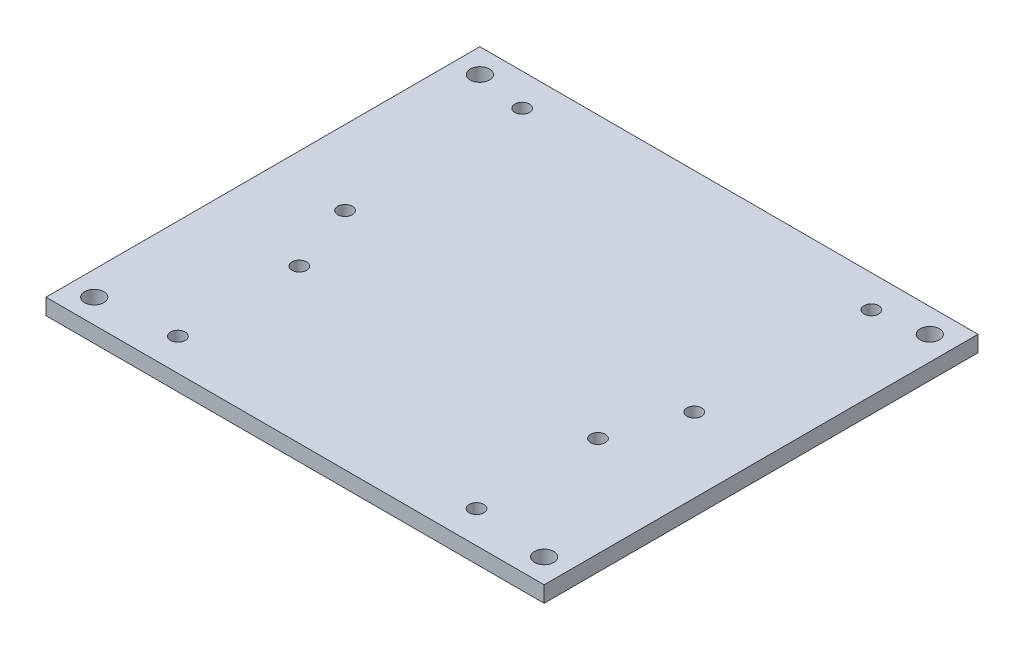
from build123d import *

# Parameters (mm, degrees)
SKETCH1_W              = 98.425
SKETCH1_H              = 85.725
BOSS_EXTRUDE1_DEPTH    = 3.175
F_6_CLEARANCE_HOLE1_D  = 3.7973
M2_5_CLEARANCE_HOLE1_D = 2.9


with BuildPart() as part:
    # Sketch1 → Boss-Extrude1 (new body)
    with BuildSketch(Plane(origin=(0, 0, 0), x_dir=(1, 0, 0), z_dir=(0, 1, 0))):
        Rectangle(SKETCH1_W, SKETCH1_H)
    extrude(amount=BOSS_EXTRUDE1_DEPTH)

    # #6 Clearance Hole1 (through all)
    with Locations(Plane(origin=(-44.45, 0, 38.1), x_dir=(0, 0, -1), z_dir=(0, -1, 0))):
        with Locations((0, 0), (0, 88.9), (76.2, 0), (76.2, 88.9)):
            Hole(F_6_CLEARANCE_HOLE1_D / 2)

    # M2.5 Clearance Hole1 (through all)
    with Locations(Plane(origin=(-29.5, 3.175, 36.5125), x_dir=(0, 0, 1), z_dir=(0, 1, 0))):
        with Locations((0, 0), (-24, 0), (-24, 59), (0, 59), (-38.025, 64), (-73.025, 64), (-73.025, -5), (-38.025, -5)):
            Hole(M2_5_CLEARANCE_HOLE1_D / 2)


solid = part.part
